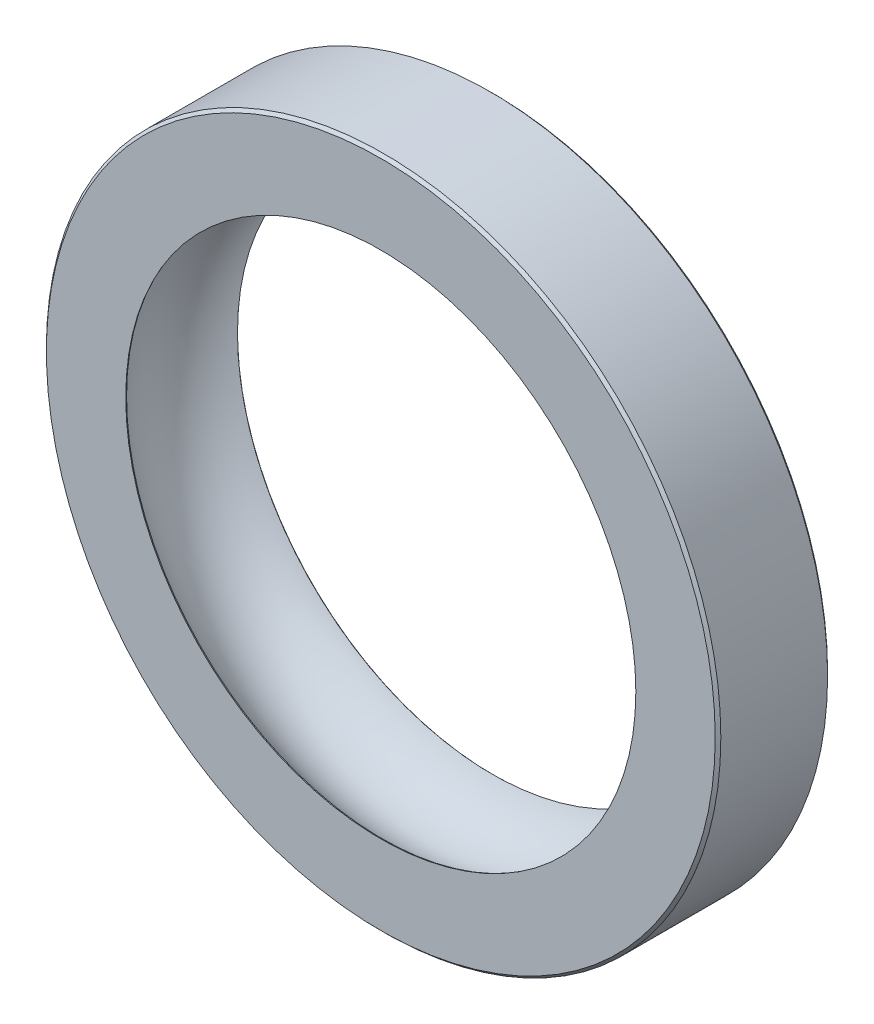
from build123d import *

# Parameters (mm, degrees)
SKETCH1_R                         = 30
BEARING_DIAMETER_DEPTH            = 10
BEARING_INNER_DIAMETER_DEPTH      = 44.588989435
BEARING_INNER_DIAMETER_DEPTH_BACK = 44.588989435
SKETCH2_R                         = 22.5
CHAMFER1_SIZE                     = 0.25
CHAMFER1_SIZE_2                   = 0.188581226


with BuildPart() as part:
    # Sketch1 → Bearing Diameter (new body)
    with BuildSketch(Plane.XY):
        Circle(SKETCH1_R)
    extrude(amount=BEARING_DIAMETER_DEPTH)

    # Sketch2 → Bearing Inner Diameter (cut, two sides: drawn at the far end of the back side and taken through both)
    with BuildSketch(Plane.XY.offset(10).offset(-BEARING_INNER_DIAMETER_DEPTH_BACK)):
        Circle(SKETCH2_R)
    extrude(amount=BEARING_INNER_DIAMETER_DEPTH + BEARING_INNER_DIAMETER_DEPTH_BACK, mode=Mode.SUBTRACT)

    # Sketch3 → Cut-Revolve2 (revolve, cut)
    with BuildSketch(Plane(origin=(0, 0, 0), x_dir=(1, 0, 0), z_dir=(0, 1, 0))):
        with BuildLine():
            Line((-22.5, 0), (-22.5, -10))
            ThreePointArc((-22.5, -10), (-25.708712153, -5), (-22.5, 0))
        make_face()
    revolve(axis=Axis((0, 0, 0), (0, 0, 1)), mode=Mode.SUBTRACT)

    # Chamfer1
    # the kernel refuses this chamfer: 0.25, 0.188581226 mm, written as the material it takes off along each edge
    with BuildSketch(Plane(origin=(0, 0, 0), x_dir=(-1, 0, 0), z_dir=(0, 1, 0))) as chamfer1_piece_1:
        with BuildLine():
            Line((22.669028641, 0.080971359), (22.5 + CHAMFER1_SIZE, 0))
            Line((22.5 + CHAMFER1_SIZE, 0), (22.5, 0))
            ThreePointArc((22.5, 0), (22.583359545, 0.039047495), (22.669028641, 0.080971359))
        make_face()
    revolve(axis=Axis((0, 0, 0), (0, 0, 1)), mode=Mode.SUBTRACT)
    with BuildSketch(Plane(origin=(0, 0, 10), x_dir=(-1, 0, 0), z_dir=(0, -1, 0))) as chamfer1_piece_2:
        with BuildLine():
            Line((22.5 + CHAMFER1_SIZE_2 * 0.999999998985, 0), (22.730207565, 0.112049419))
            ThreePointArc((22.730207565, 0.112049419), (22.619010369, 0.056270385), (22.5, 0))
            Line((22.5, 0), (22.5 + CHAMFER1_SIZE_2 * 0.999999998985, 0))
        make_face()
    revolve(axis=Axis((0, 0, 10), (0, 0, -1)), mode=Mode.SUBTRACT)
    with BuildSketch(Plane(origin=(0, 0, 0), x_dir=(1, 0, 0), z_dir=(0, -1, 0))) as chamfer1_piece_3:
        Polygon((30, CHAMFER1_SIZE), (30 - CHAMFER1_SIZE, 0), (30, 0), align=None)
    revolve(axis=Axis((0, 0, 0), (0, 0, 1)), mode=Mode.SUBTRACT)
    with BuildSketch(Plane(origin=(0, 0, 10), x_dir=(1, 0, 0), z_dir=(0, -1, 0))) as chamfer1_piece_4:
        Polygon((30, -CHAMFER1_SIZE), (30 - CHAMFER1_SIZE, 0), (30, 0), align=None)
    revolve(axis=Axis((0, 0, 10), (0, 0, 1)), mode=Mode.SUBTRACT)


solid = part.part
